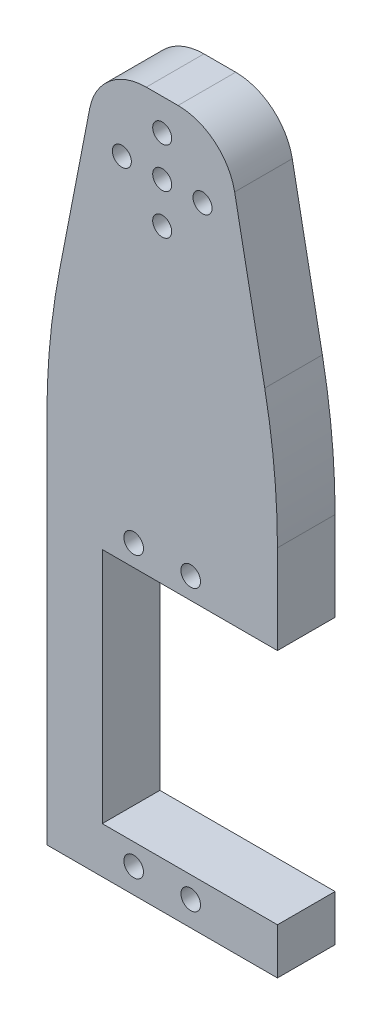
from build123d import *

# Parameters (mm, degrees)
SKETCH2_W           = 40
SKETCH2_H           = 122.5
BOSS_EXTRUDE1_DEPTH = 10
SKETCH3_R           = 1.7
SKETCH3_W           = 20.8
SKETCH3_H           = 41.2
CUT_EXTRUDE3_DEPTH  = 130.252659547
SKETCH4_R           = 1.65
CUT_EXTRUDE4_DEPTH  = 130.252659547
SKETCH5_W           = 30.4
SKETCH5_H           = 41.2
SKETCH5_W_2         = 9
SKETCH5_H_2         = 52.5
CUT_EXTRUDE5_DEPTH  = 130.252659547
DRAFT11_DEPTH       = 10
FILLET4_R           = 120
FILLET5_R           = 10


# Read off the part's stored shape, not the designer's step: Draft11
with BuildPart() as part:
    # Sketch2 → Boss-Extrude1 (new body)
    with BuildSketch(Plane.XY):
        with Locations((-20, 61.25)):
            Rectangle(SKETCH2_W, SKETCH2_H)
    extrude(amount=BOSS_EXTRUDE1_DEPTH)

    # Sketch3 → Cut-Extrude3 (cut, through all)
    with BuildSketch(Plane.XY):
        with Locations((-24.95, 4.3)):
            Circle(SKETCH3_R)
        with Locations((-15.05, 4.3)):
            Circle(SKETCH3_R)
        with Locations(Location((-15.05, 52.9, 0), (0, 0, 180))):
            Circle(SKETCH3_R)
        with Locations(Location((-24.95, 52.9, 0), (0, 0, 180))):
            Circle(SKETCH3_R)
        with Locations((-20, 28.6)):
            Rectangle(SKETCH3_W, SKETCH3_H)
    extrude(amount=CUT_EXTRUDE3_DEPTH, mode=Mode.SUBTRACT)

    # Sketch4 → Cut-Extrude4 (cut, through all)
    with BuildSketch(Plane.XY.offset(10)):
        with Locations((-20, 110)):
            Circle(SKETCH4_R)
        with Locations((-27, 110)):
            Circle(SKETCH4_R)
        with Locations((-20, 117)):
            Circle(SKETCH4_R)
        with Locations((-13, 110)):
            Circle(SKETCH4_R)
        with Locations((-20, 103)):
            Circle(SKETCH4_R)
    extrude(amount=-CUT_EXTRUDE4_DEPTH, mode=Mode.SUBTRACT)

    # Sketch5 → Cut-Extrude5 (cut, through all)
    with BuildSketch(Plane.XY.offset(10)):
        with Locations((-15.2, 28.6)):
            Rectangle(SKETCH5_W, SKETCH5_H)
        with Locations((-35.5, 96.25)):
            Rectangle(SKETCH5_W_2, SKETCH5_H_2)
        with Locations((-4.5, 96.25)):
            Rectangle(SKETCH5_W_2, SKETCH5_H_2)
    extrude(amount=-CUT_EXTRUDE5_DEPTH, mode=Mode.SUBTRACT)

    # Draft11 outline → Draft11 (add)
    with BuildSketch(Plane.XY):
        Polygon((0, 70), (0, 76.199013856), (-9, 122.5), (-9, 70), align=None)
        Polygon((-31, 70), (-31, 122.5), (-40, 76.199013856), (-40, 70), align=None)
    extrude(amount=DRAFT11_DEPTH)

    # Fillet4
    fillet4_edges = [part.edges().sort_by_distance(p)[0] for p in [
        (0, 76.199013856, 5),
        (-40, 76.199013856, 5),
    ]]
    fillet(fillet4_edges, radius=FILLET4_R)

    # Fillet5
    fillet5_edges = [part.edges().sort_by_distance(p)[0] for p in [
        (-9, 122.5, 5),
        (-31, 122.5, 5),
    ]]
    fillet(fillet5_edges, radius=FILLET5_R)


solid = part.part
